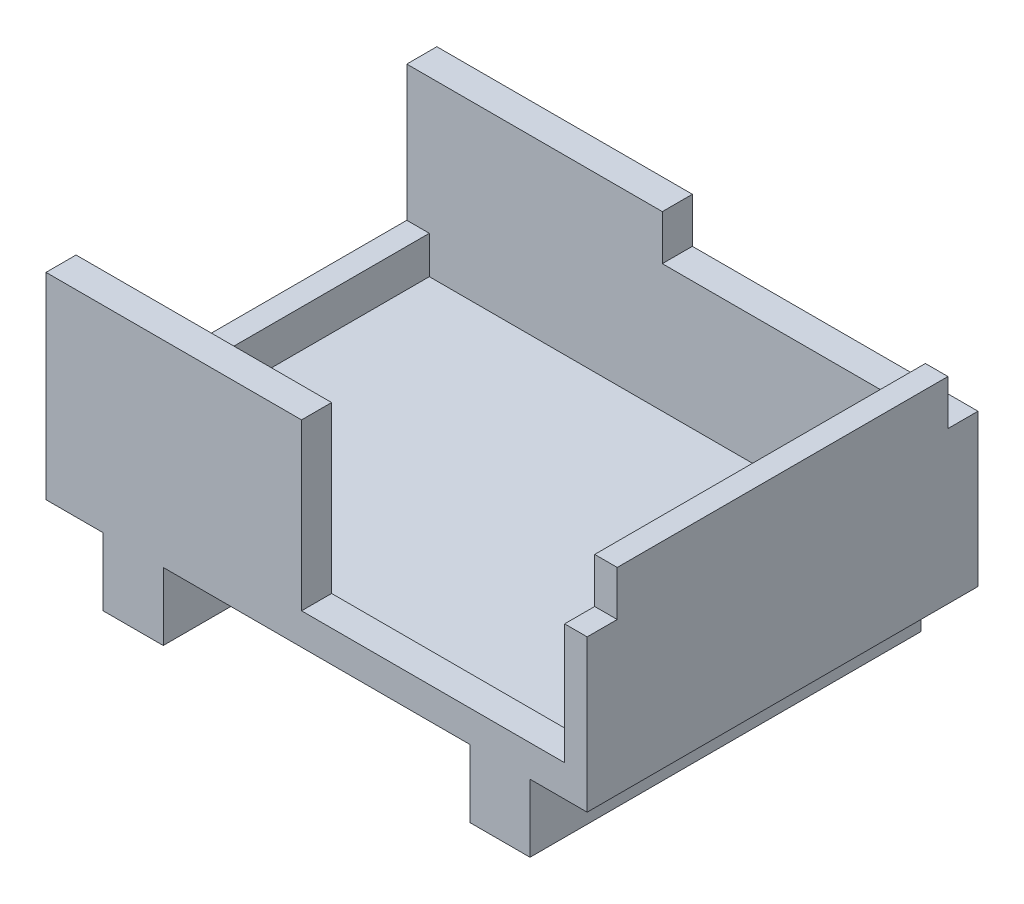
from build123d import *

# Parameters (mm, degrees)
SKETCH_1_W          = 36
SKETCH_1_H          = 26
EXTRUDE_1_DEPTH     = 14.6
SKETCH_2_W          = 33
SKETCH_2_H          = 22
CUT_EXTRUDE_1_DEPTH = 13
SKETCH_3_W          = 36
SKETCH_3_H          = 26
CUT_EXTRUDE_2_DEPTH = 4.5
SKETCH_4_W          = 1.5
SKETCH_4_H          = 22
CUT_EXTRUDE_3_DEPTH = 6
SKETCH_7_W          = 17
SKETCH_7_H          = 2
SKETCH_7_W_2        = 1.5
SKETCH_7_H_2        = 22
EXTRUDE_4_DEPTH     = 3
SKETCH_5_W          = 4
SKETCH_5_H          = 3
EXTRUDE_5_DEPTH     = 2
SKETCH_8_W          = 4
SKETCH_8_H          = 26
EXTRUDE_6_DEPTH     = 2.5
SKETCH_10_W         = 17.5
SKETCH_10_H         = 2
CUT_EXTRUDE_4_DEPTH = 8


with BuildPart() as part:
    # 草图1 → 凸台-拉伸1 (new body)
    with BuildSketch(Plane(origin=(0, 0, 0), x_dir=(1, 0, 0), z_dir=(0, 1, 0))):
        Rectangle(SKETCH_1_W, SKETCH_1_H)
    extrude(amount=EXTRUDE_1_DEPTH)

    # 草图2 → 切除-拉伸1 (cut)
    with BuildSketch(Plane(origin=(0, 14.6, 0), x_dir=(1, 0, 0), z_dir=(0, 1, 0))):
        Rectangle(SKETCH_2_W, SKETCH_2_H)
    extrude(amount=-CUT_EXTRUDE_1_DEPTH, mode=Mode.SUBTRACT)

    # 草图3 → 切除-拉伸2 (cut)
    with BuildSketch(Plane(origin=(0, 14.6, 0), x_dir=(1, 0, 0), z_dir=(0, 1, 0))):
        Rectangle(SKETCH_3_W, SKETCH_3_H)
    extrude(amount=-CUT_EXTRUDE_2_DEPTH, mode=Mode.SUBTRACT)

    # 草图4 → 切除-拉伸3 (cut)
    with BuildSketch(Plane(origin=(0, 10.1, 0), x_dir=(1, 0, 0), z_dir=(0, 1, 0))):
        with Locations((-17.25, 0)):
            Rectangle(SKETCH_4_W, SKETCH_4_H)
    extrude(amount=-CUT_EXTRUDE_3_DEPTH, mode=Mode.SUBTRACT)

    # 草图7 → 凸台-拉伸4 (add)
    with BuildSketch(Plane(origin=(0, 10.1, 0), x_dir=(1, 0, 0), z_dir=(0, 1, 0))):
        with Locations((-9.5, 12)):
            Rectangle(SKETCH_7_W, SKETCH_7_H)
        with Locations((-9.5, -12)):
            Rectangle(SKETCH_7_W, SKETCH_7_H)
        with Locations((17.25, 0)):
            Rectangle(SKETCH_7_W_2, SKETCH_7_H_2)
    extrude(amount=EXTRUDE_4_DEPTH)

    # 草图5 → 凸台-拉伸5 (add)
    with BuildSketch(Plane(origin=(0, 0, 0), x_dir=(-1, 0, 0), z_dir=(0, -1, 0))):
        with Locations((-12.2, -11.5)):
            Rectangle(SKETCH_5_W, SKETCH_5_H)
        with Locations((12.2, -11.5)):
            Rectangle(SKETCH_5_W, SKETCH_5_H)
        with Locations((-12.2, 11.5)):
            Rectangle(SKETCH_5_W, SKETCH_5_H)
        with Locations((12.2, 11.5)):
            Rectangle(SKETCH_5_W, SKETCH_5_H)
    extrude(amount=EXTRUDE_5_DEPTH)

    # 草图8 → 凸台-拉伸6 (add)
    with BuildSketch(Plane(origin=(0, -2, 0), x_dir=(-1, 0, 0), z_dir=(0, -1, 0))):
        with Locations((-12.2, 0)):
            Rectangle(SKETCH_8_W, SKETCH_8_H)
        with Locations((12.2, 0)):
            Rectangle(SKETCH_8_W, SKETCH_8_H)
    extrude(amount=EXTRUDE_6_DEPTH)

    # 草图10 → 切除-拉伸4 (cut)
    with BuildSketch(Plane(origin=(0, 10.1, 0), x_dir=(1, 0, 0), z_dir=(0, 1, 0))):
        with Locations((7.75, -12)):
            Rectangle(SKETCH_10_W, SKETCH_10_H)
    extrude(amount=-CUT_EXTRUDE_4_DEPTH, mode=Mode.SUBTRACT)


solid = part.part
